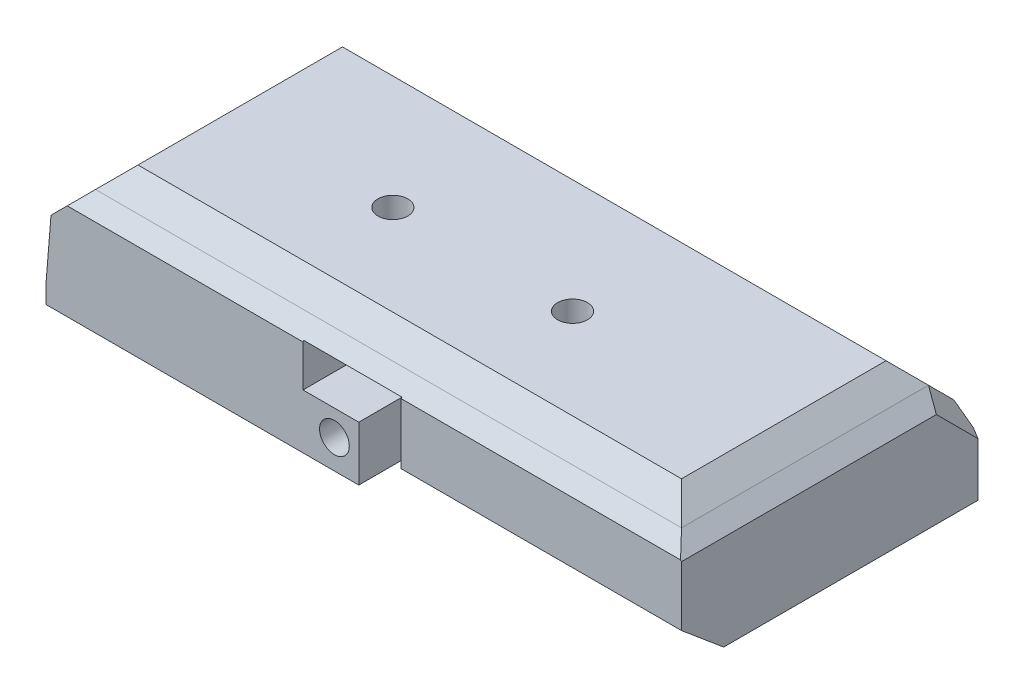
from build123d import *
from OCP.BRepAlgoAPI import BRepAlgoAPI_Cut
from OCP.TopTools import TopTools_ListOfShape
from OCP.BRepFilletAPI import BRepFilletAPI_MakeChamfer

# Parameters (mm, degrees)
BOSS_EXTRUDE1_DEPTH = 8.206
SKETCH2_W           = 36.828862806
SKETCH2_H           = 41.91
BOSS_EXTRUDE2_DEPTH = 7.37662
SKETCH3_W           = 41.91
SKETCH3_H           = 2.37661953
BOSS_EXTRUDE3_DEPTH = 53
SKETCH4_W           = 40.118833935
SKETCH4_H           = 41.91
BOSS_EXTRUDE4_DEPTH = 13.206
SKETCH6_R           = 2.11
CUT_EXTRUDE1_DEPTH  = 8
CHAMFER1_SIZE       = 5
CHAMFER2_START      = -34
CHAMFER2_OUTLINE_W  = 14
CHAMFER2_OUTLINE_H  = 11
CHAMFER2_DEPTH      = 2.19717655
CHAMFER3_SIZE       = 5
CHAMFER6_START      = -8
CHAMFER6_OUTLINE_W  = 11
CHAMFER6_OUTLINE_H  = 14
CHAMFER6_DEPTH      = 1.978157275
CHAMFER7_SIZE       = 2
CHAMFER7_SIZE2      = 2.14473742
CHAMFER8_SIZE       = 2
CHAMFER9_SIZE       = 5
CHAMFER9_SIZE2      = 5.958767963
SKETCH7_R           = 2.1
CUT_EXTRUDE2_DEPTH  = 52
CUT_EXTRUDE3_DEPTH  = 41.91
BOSS_EXTRUDE6_START = 3
SKETCH11_W          = 82.828862806
SKETCH11_H          = 34.91
SKETCH11_R          = 2.11
BOSS_EXTRUDE6_DEPTH = 3
CHAMFER10_SIZE      = 3
CHAMFER11_SIZE      = 3
CHAMFER12_SIZE      = 3
CHAMFER13_SIZE      = 3


with BuildPart() as part:
    # Sketch1 → Boss-Extrude1 (new body)
    with BuildSketch(Plane(origin=(0, 0, 0), x_dir=(1, 0, 0), z_dir=(0, 1, 0))):
        Polygon((39.477316318, 14.786556642), (39.477316318, 31.587309514), (-5.232712553, 31.587309514), (-5.232712553, -10.322690486), (39.477316318, -10.322690486), align=None)
    extrude(amount=BOSS_EXTRUDE1_DEPTH)

    # Sketch2 → Boss-Extrude2 (add)
    with BuildSketch(Plane(origin=(0, 8.206, 0), x_dir=(1, 0, 0), z_dir=(0, 1, 0))):
        with Locations((13.18171885, 10.632309514)):
            Rectangle(SKETCH2_W, SKETCH2_H)
    extrude(amount=BOSS_EXTRUDE2_DEPTH)

    # Sketch3 → Boss-Extrude3 (add)
    with BuildSketch(Plane(origin=(31.596150253, 0, 0), x_dir=(0, 0, -1), z_dir=(1, 0, 0))):
        with Locations((10.632309514, 14.394309765)):
            Rectangle(SKETCH3_W, SKETCH3_H)
    extrude(amount=BOSS_EXTRUDE3_DEPTH)

    # Sketch4 → Boss-Extrude4 (add)
    with BuildSketch(Plane.XZ.offset(-13.206)):
        with Locations((64.536733286, -10.632309514)):
            Rectangle(SKETCH4_W, SKETCH4_H)
    extrude(amount=BOSS_EXTRUDE4_DEPTH)


with BuildPart() as cut_extrude1_tool:
    # Sketch6 → Cut-Extrude1 (new body)
    with BuildSketch(Plane(origin=(0, 15.58261953, 0), x_dir=(1, 0, 0), z_dir=(0, 1, 0))):
        with Locations(Location((25.978877621, 7.491265073, 0), (0, 0, 270))):
            Circle(SKETCH6_R)
        with Locations(Location((51.378877239, 7.491265073, 0), (0, 0, 270))):
            Circle(SKETCH6_R)
    extrude(amount=-CUT_EXTRUDE1_DEPTH)


with BuildPart() as part_1:
    add(part.part)

    # Cut-Extrude1: cut by cut_extrude1_tool, with a tolerance
    cut_extrude1_stock = TopTools_ListOfShape()
    cut_extrude1_stock.Append(part_1.part.wrapped)
    cut_extrude1_tools = TopTools_ListOfShape()
    cut_extrude1_tools.Append(cut_extrude1_tool.part.wrapped)
    cut_extrude1_cut = BRepAlgoAPI_Cut()
    cut_extrude1_cut.SetArguments(cut_extrude1_stock)
    cut_extrude1_cut.SetTools(cut_extrude1_tools)
    cut_extrude1_cut.SetFuzzyValue(0.00001)
    cut_extrude1_cut.Build()
    add(Compound.cast(cut_extrude1_cut.Shape()).solids(), mode=Mode.REPLACE)

    # Chamfer1
    # the kernel refuses this chamfer: 5 mm, written as the material it takes off along each edge
    with BuildSketch(Plane(origin=(31.596150253, 15.58261953, -31.587309514), x_dir=(0, -1, 0), z_dir=(1, 0, 0))) as chamfer1_piece_1:
        Polygon((CHAMFER1_SIZE, 0), (0, -CHAMFER1_SIZE), (0, 0), align=None)
    extrude(amount=65.85841494, mode=Mode.SUBTRACT)
    with BuildSketch(Plane(origin=(-18.091127493, 15.58262, -31.587309514), x_dir=(0, -1, 0), z_dir=(1, 0, 0))) as chamfer1_piece_2:
        Polygon((CHAMFER1_SIZE, 0), (0, -CHAMFER1_SIZE), (0, 0), align=None)
    extrude(amount=49.687277746, mode=Mode.SUBTRACT)

    # Chamfer2: read off the stored shape, not the designer's step
    # Chamfer2 outline → Chamfer2 (cut)
    with BuildSketch(Plane(origin=(0, 0, 0), x_dir=(0.9916852119709467, 0.06123073523081426, -0.11318673694930956), z_dir=(0.128687374509461, -0.47185370653469005, 0.8722348532771071)).offset(CHAMFER2_START)):
        with Locations((4, -4.5)):
            Rectangle(CHAMFER2_OUTLINE_W, CHAMFER2_OUTLINE_H)
    extrude(amount=CHAMFER2_DEPTH, mode=Mode.SUBTRACT)

    # Chamfer3
    chamfer3_edges = [part_1.edges().sort_by_distance(p)[0] for p in [
        (-5.232712553, 15.58262, -8.132309514),
    ]]
    chamfer(chamfer3_edges, length=CHAMFER3_SIZE)

    # Chamfer6: read off the stored shape, not the designer's step
    # Chamfer6 outline → Chamfer6 (cut)
    with BuildSketch(Plane(origin=(0, 0, 0), x_dir=(0.08066336673472338, 0.9967300157061612, -0.004764142883599942), z_dir=(0.9949960919345852, -0.08080393425072713, -0.058766497636892415)).offset(CHAMFER6_START)):
        with Locations((6.5, 5)):
            Rectangle(CHAMFER6_OUTLINE_W, CHAMFER6_OUTLINE_H)
    extrude(amount=CHAMFER6_DEPTH, mode=Mode.SUBTRACT)

    # Chamfer7: one chamfer whose edges measure the first distance from different faces: ONE call of the kernel's chamfer builder (chamfer() names one face for all edges)
    chamfer7_edges_1 = [part_1.edges().sort_by_distance(p)[0] for p in [
        (84.596150253, 15.58261953, -8.132309514),
    ]]
    chamfer7_side_1 = [part_1.faces().sort_by_distance(p)[0] for p in [
        (58.144523378, 15.58261953, -8.13692587),
    ]]
    chamfer7_edges_2 = [part_1.edges().sort_by_distance(p)[0] for p in [
        (84.596150253, 13.08261953, -29.087309514),
    ]]
    chamfer7_side_2 = [part_1.faces().sort_by_distance(p)[0] for p in [
        (61.027936369, 13.256297064, -28.91363198),
    ]]
    chamfer7 = BRepFilletAPI_MakeChamfer(part_1.part.solid().wrapped)
    for e in chamfer7_edges_1:
        chamfer7.Add(CHAMFER7_SIZE, CHAMFER7_SIZE2, e.wrapped, chamfer7_side_1[0].wrapped)  # the first distance lies on this face
    for e in chamfer7_edges_2:
        chamfer7.Add(CHAMFER7_SIZE, CHAMFER7_SIZE2, e.wrapped, chamfer7_side_2[0].wrapped)  # the first distance lies on this face
    add(Compound.cast(chamfer7.Shape()), mode=Mode.REPLACE)

    # Chamfer8
    chamfer8_edges = [part_1.edges().sort_by_distance(p)[0] for p in [
        (63.536733285, 10.58261953, -31.587309514),
        (57.096150253, 15.58261953, 10.322690486),
    ]]
    chamfer(chamfer8_edges, length=CHAMFER8_SIZE)

    # Chamfer9
    chamfer9_edges = [part_1.edges().sort_by_distance(p)[0] for p in [
        (64.536733285, 0, 10.322690486),
    ]]
    chamfer9_side = [part_1.faces().sort_by_distance(p)[0] for p in [
        (83.864230917, 12.890655698, 10.322690486),
    ]]
    chamfer(chamfer9_edges, length=CHAMFER9_SIZE, length2=CHAMFER9_SIZE2, reference=chamfer9_side[0])

    # Sketch7 → Cut-Extrude2 (cut)
    with BuildSketch(Plane.XY.offset(10.322690486)):
        with Locations((35.536733285, 4.103)):
            Circle(SKETCH7_R)
    extrude(amount=-CUT_EXTRUDE2_DEPTH, mode=Mode.SUBTRACT)

    # Sketch9 → Cut-Extrude3 (cut)
    with BuildSketch(Plane.XY.offset(10.322690486)):
        Polygon((31.596150253, 7.706), (38.977316318, 7.706), (38.977316318, 0), (39.477316318, 0), (39.477316318, 8.206), (31.596150253, 8.206), (31.596150253, 13.206), (44.477316318, 13.206), (44.477316318, 0), (44.977316318, 0), (44.977316318, 13.58261953), (44.977316318, 13.706), (44.477316318, 13.706), (31.096150253, 13.706), (31.096150253, 13.58261953), (31.096150253, 13.206), (31.096150253, 7.706), align=None)
    extrude(amount=-CUT_EXTRUDE3_DEPTH, mode=Mode.SUBTRACT)

    # Sketch11 → Boss-Extrude6 (add)
    with BuildSketch(Plane(origin=(0, 15.58261953, 0), x_dir=(1, 0, 0), z_dir=(0, 1, 0)).offset(BOSS_EXTRUDE6_START)):
        with Locations((41.18171885, 9.132309514)):
            Rectangle(SKETCH11_W, SKETCH11_H)
        with Locations(Location((25.978877621, 7.491265073, 0), (0, 0, 270))):
            Circle(SKETCH11_R, mode=Mode.SUBTRACT)
        with Locations(Location((51.378877239, 7.491265073, 0), (0, 0, 270))):
            Circle(SKETCH11_R, mode=Mode.SUBTRACT)
    extrude(amount=-BOSS_EXTRUDE6_DEPTH)

    # Chamfer10
    chamfer10_edges = [part_1.edges().sort_by_distance(p)[0] for p in [
        (41.18171885, 18.58261953, 8.322690486),
    ]]
    chamfer(chamfer10_edges, length=CHAMFER10_SIZE - 0.0001)  # a hair under: the kernel refuses the full size

    # Chamfer11
    chamfer11_edges = [part_1.edges().sort_by_distance(p)[0] for p in [
        (82.596150253, 18.58261953, -10.632259514),
    ]]
    chamfer(chamfer11_edges, length=CHAMFER11_SIZE - 0.0001)  # a hair under: the kernel refuses the full size

    # Chamfer12
    chamfer12_edges = [part_1.edges().sort_by_distance(p)[0] for p in [
        (39.68176885, 18.58261953, -26.587309514),
    ]]
    chamfer(chamfer12_edges, length=CHAMFER12_SIZE - 0.0001)  # a hair under: the kernel refuses the full size

    # Chamfer13
    chamfer13_edges = [part_1.edges().sort_by_distance(p)[0] for p in [
        (-0.232712553, 18.58261953, -9.132309514),
    ]]
    chamfer(chamfer13_edges, length=CHAMFER13_SIZE)


solid = part_1.part
